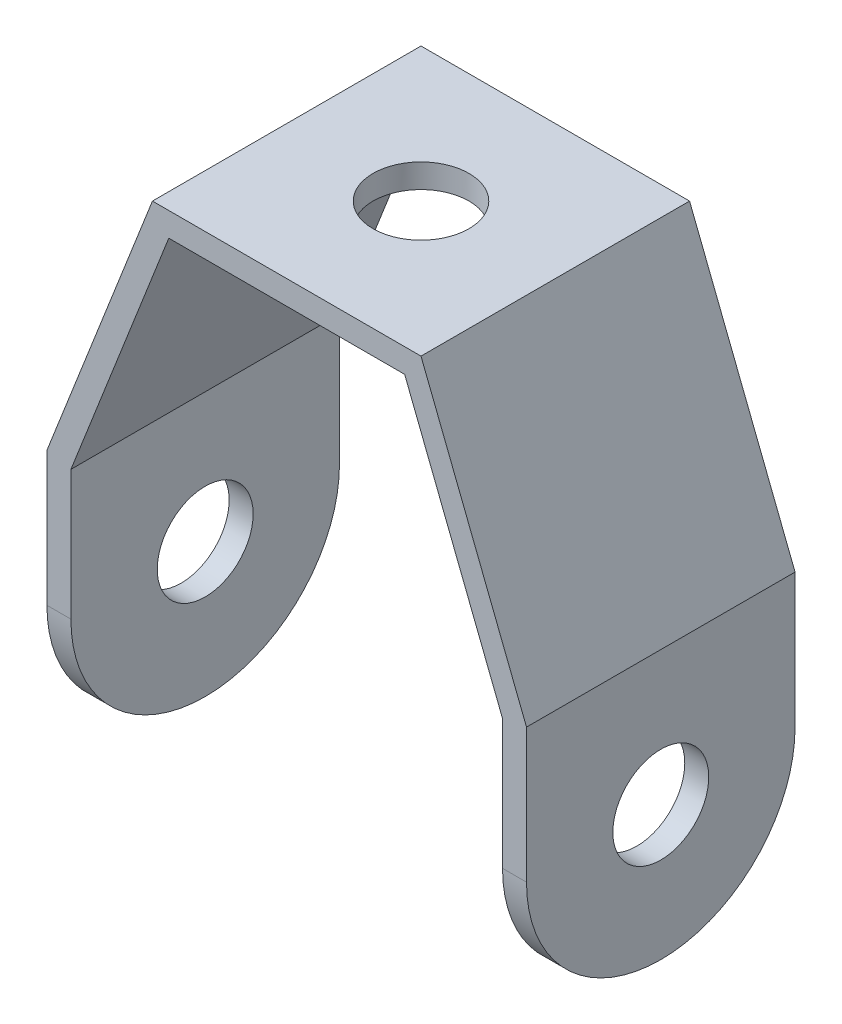
from build123d import *

# Parameters (mm, degrees)
ESBO_O1_W                  = 50
ESBO_O1_H                  = 56
RESSALTO_EXTRUS_O1_DEPTH   = 28
CORTE_EXTRUS_O1_DEPTH      = 28
CORTE_EXTRUS_O7_DEPTH      = 28
CORTE_EXTRUS_O7_DEPTH_BACK = 28
ESBO_O7_R                  = 5
CORTE_EXTRUS_O8_DEPTH      = 64.780874876
ESBO_O8_R                  = 5
CORTE_EXTRUS_O9_DEPTH      = 68.416615163
FILETE7_R                  = 14
FILETE8_R                  = 14


with BuildPart() as part:
    # Esboço1 → Ressalto-extrusão1 (new body)
    with BuildSketch(Plane.XY):
        Rectangle(ESBO_O1_W, ESBO_O1_H)
    extrude(amount=RESSALTO_EXTRUS_O1_DEPTH)

    # Esboço5 → Corte-extrusão1 (cut)
    with BuildSketch(Plane.XY.offset(28)):
        Polygon((-22.5, -0.473458617), (-22.5, -28), (22.5, -28), (22.5, -0.473458617), (12.296141258, 25.5), (0, 25.5), (-12.296141258, 25.5), align=None)
    extrude(amount=-CORTE_EXTRUS_O1_DEPTH, mode=Mode.SUBTRACT)

    # Esboço2 → Corte-extrusão7 (cut, two sides: drawn at the far end of the back side and taken through both)
    with BuildSketch(Plane.XY.offset(-CORTE_EXTRUS_O7_DEPTH_BACK)):
        Polygon((-14, 28), (-25, 28), (-25, 0), align=None)
        Polygon((25, 0), (25, 28), (14, 28), align=None)
    extrude(amount=CORTE_EXTRUS_O7_DEPTH + CORTE_EXTRUS_O7_DEPTH_BACK, mode=Mode.SUBTRACT)

    # Esboço7 → Corte-extrusão8 (cut, through all)
    with BuildSketch(Plane.ZY.offset(25)):
        with Locations(Location((14, -14, 0), (0, 0, 270))):
            Circle(ESBO_O7_R)
    extrude(amount=-CORTE_EXTRUS_O8_DEPTH, mode=Mode.SUBTRACT)

    # Esboço8 → Corte-extrusão9 (cut, through all)
    with BuildSketch(Plane(origin=(0, 28, 0), x_dir=(1, 0, 0), z_dir=(0, 1, 0))):
        with Locations(Location((0, -14, 0), (0, 0, 270))):
            Circle(ESBO_O8_R)
    extrude(amount=-CORTE_EXTRUS_O9_DEPTH, mode=Mode.SUBTRACT)

    # Filete7
    filete7_edges = [part.edges().sort_by_distance(p)[0] for p in [
        (-23.75, -28, 0),
        (-23.75, -28, 28),
    ]]
    fillet(filete7_edges, radius=FILETE7_R - 0.0001)  # a hair under: the kernel refuses the full size

    # Filete8
    filete8_edges = [part.edges().sort_by_distance(p)[0] for p in [
        (23.75, -28, 28),
        (23.75, -28, 0),
    ]]
    fillet(filete8_edges, radius=FILETE8_R - 0.0001)  # a hair under: the kernel refuses the full size


solid = part.part
